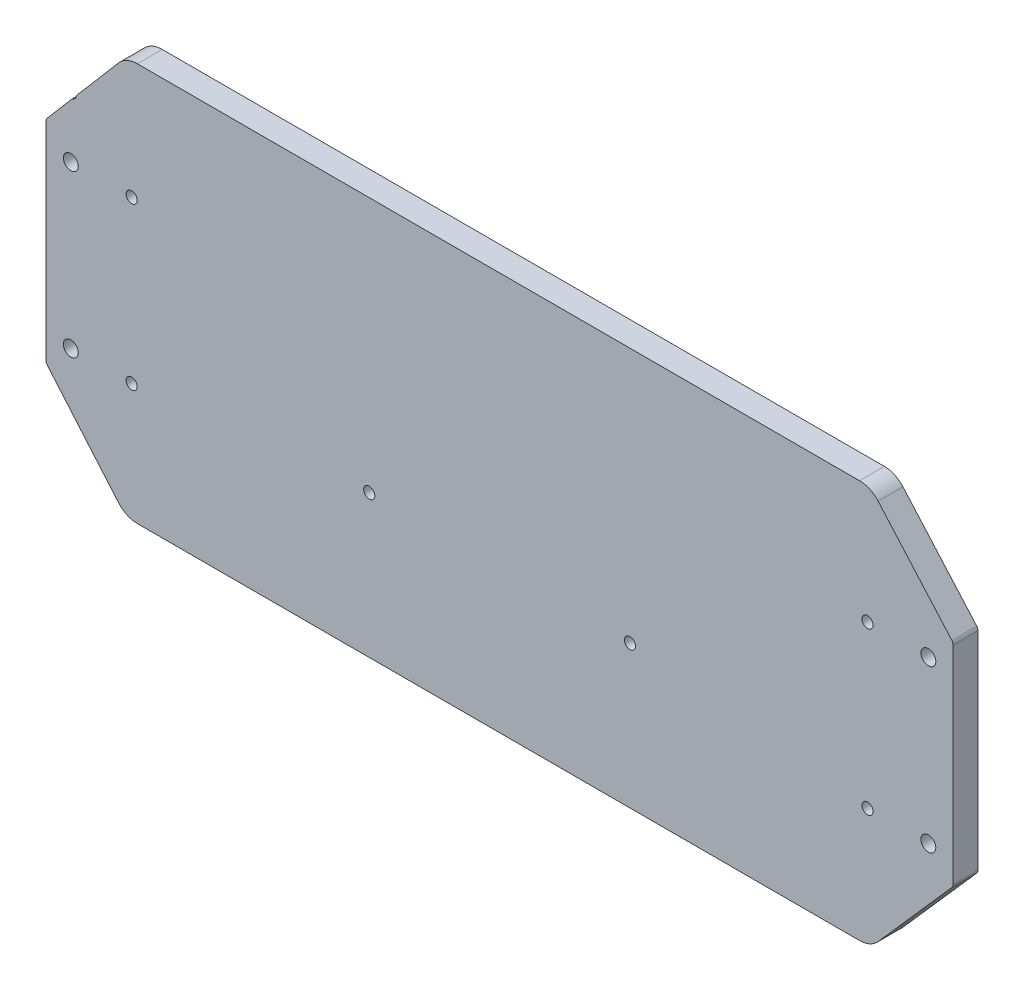
from build123d import *

# Parameters (mm, degrees)
BOSS_EXTRU_1_DEPTH      = 10
ESQUISSE3_R             = 2.25
ESQUISSE3_R_2           = 3
ENL_V_MAT_EXTRU_1_DEPTH = 10
ESQUISSE4_R             = 2.25
ENL_V_MAT_EXTRU_2_DEPTH = 10
CONG_1_R                = 10
CONG_2_R                = 2


with BuildPart() as part:
    # Esquisse1 → Boss.-Extru.1 (new body)
    with BuildSketch(Plane.XY):
        Polygon((-150, 80.2), (-182.2, 42.5), (-182.2, -42.5), (-150, -80.2), (150, -80.2), (183.2, -42.5), (183.2, 42.5), (150, 80.2), align=None)
    extrude(amount=BOSS_EXTRU_1_DEPTH)

    # Esquisse3 → Enlèv. mat.-Extru.1 (cut)
    with BuildSketch(Plane.XY.offset(10)):
        with Locations((-147.7, 32.5)):
            Circle(ESQUISSE3_R)
        with Locations((-172.2, 32.5)):
            Circle(ESQUISSE3_R_2)
        with Locations((-172.2, 57)):
            Circle(ESQUISSE3_R)
        with Locations((-172.2, -32.5)):
            Circle(ESQUISSE3_R_2)
        with Locations((-147.7, -32.5)):
            Circle(ESQUISSE3_R)
        with Locations((173.2, -32.5)):
            Circle(ESQUISSE3_R_2)
        with Locations((148.7, -32.5)):
            Circle(ESQUISSE3_R)
        with Locations((173.2, 32.5)):
            Circle(ESQUISSE3_R_2)
        with Locations((148.7, 32.5)):
            Circle(ESQUISSE3_R)
    extrude(amount=-ENL_V_MAT_EXTRU_1_DEPTH, mode=Mode.SUBTRACT)

    # Esquisse4 → Enlèv. mat.-Extru.2 (cut)
    with BuildSketch(Plane.XY.offset(10)):
        with Locations((-52, -22.7)):
            Circle(ESQUISSE4_R)
        with Locations((53, -22.7)):
            Circle(ESQUISSE4_R)
    extrude(amount=-ENL_V_MAT_EXTRU_2_DEPTH, mode=Mode.SUBTRACT)

    # Congé1
    cong_1_edges = [part.edges().sort_by_distance(p)[0] for p in [
        (-150, 80.2, 5),
        (150, 80.2, 5),
        (150, -80.2, 5),
        (-150, -80.2, 5),
    ]]
    fillet(cong_1_edges, radius=CONG_1_R)

    # Congé2
    cong_2_edges = [part.edges().sort_by_distance(p)[0] for p in [
        (-182.2, -42.5, 5),
        (-182.2, 42.5, 5),
        (183.2, -42.5, 5),
        (183.2, 42.5, 5),
    ]]
    fillet(cong_2_edges, radius=CONG_2_R)


solid = part.part
